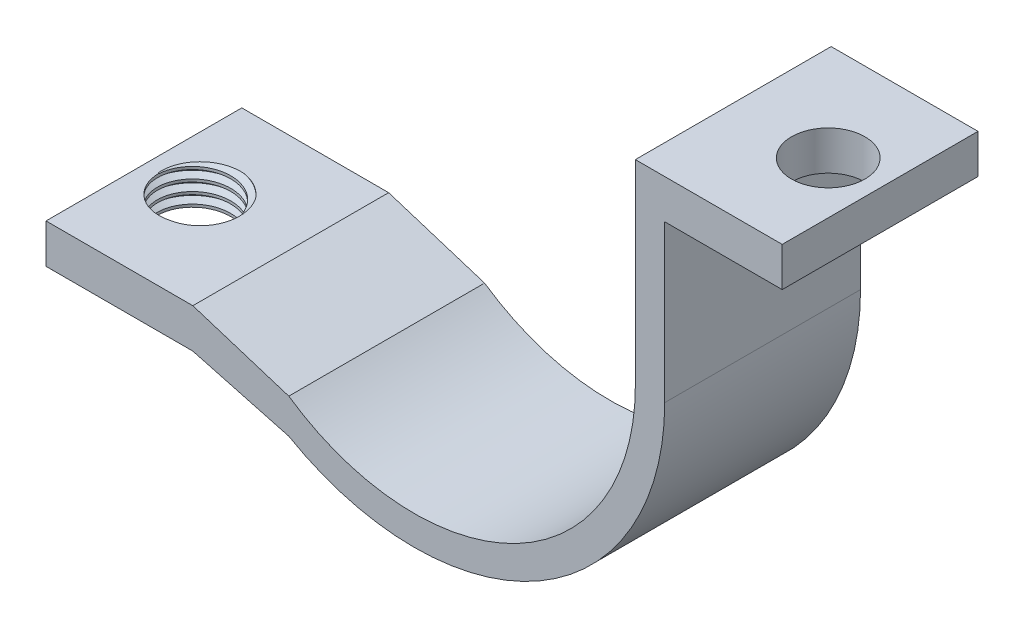
from build123d import *

# Parameters (mm, degrees)
BOSS_EXTRUDE3_DEPTH = 25.4
SKETCH7_R           = 4.7625
CUT_EXTRUDE1_DEPTH  = 54.102
THREAD1_PITCH       = 1.411111111


with BuildPart() as part:
    # Sketch5 → Boss-Extrude3 (new body)
    with BuildSketch(Plane.XY):
        with BuildLine():
            Line((28.702, 0), (28.702, 25.4))
            Line((28.702, 25.4), (32.512, 25.4))
            Line((32.512, 25.4), (47.752, 25.4))
            Line((47.752, 25.4), (47.752, 20.32))
            Line((47.752, 20.32), (32.512, 20.32))
            Line((32.512, 20.32), (32.512, 0))
            ThreePointArc((32.512, 0), (16.256, -28.156217928), (-16.256, -28.156217928))
            Line((-16.256, -28.156217928), (-28.702, -24.821322279))
            Line((-28.702, -24.821322279), (-47.752, -24.821322279))
            Line((-47.752, -24.821322279), (-47.752, -19.716890163))
            Line((-47.752, -19.716890163), (-28.702, -19.716890163))
            Line((-28.702, -19.716890163), (-16.256, -23.654751489))
            ThreePointArc((-16.256, -23.654751489), (13.36460048, -25.400634992), (28.702, 0))
        make_face()
    extrude(amount=BOSS_EXTRUDE3_DEPTH)

    # Sketch7 → Cut-Extrude1 (cut)
    with BuildSketch(Plane(origin=(0, 25.4, 0), x_dir=(1, 0, 0), z_dir=(0, 1, 0))):
        with Locations(Location((-41.021, -12.7, 0), (0, 0, 270))):
            Circle(SKETCH7_R)
        with Locations(Location((41.021, -12.7, 0), (0, 0, 270))):
            Circle(SKETCH7_R)
    extrude(amount=-CUT_EXTRUDE1_DEPTH, mode=Mode.SUBTRACT)

    # Thread1: the profile of Thread Profile1 profile screwed along a right-hand helix of 4.325976 turns, 8 arcs to a turn; built about Z, then put on its axis
    thread1_z = Axis((0, 0, 0), (0, 0, 1))
    thread1_corners = [(4.7622, 0, -0.000173205), (5.52628629, 0, 0.44097222), (5.52628629, 0, 0.617361109), (4.7622, 0, 1.058506535)]
    with BuildLine(mode=Mode.PRIVATE) as thread1_profile:
        Line(thread1_corners[0], thread1_corners[1])
        Line(thread1_corners[1], thread1_corners[2])
        Line(thread1_corners[2], thread1_corners[3])
        Line(thread1_corners[3], thread1_corners[0])
    thread1_cap = Face(thread1_profile.wire())
    thread1_turn_angles = [0, 22.5, 45, 67.5, 90, 112.5, 135, 157.5, 180, 202.5, 225, 247.5, 270, 292.5, 315, 337.5, 360]
    thread1_turn_weights = [1, 0.9238795325112867, 1, 0.9238795325112867, 1, 0.9238795325112867, 1, 0.9238795325112867, 1, 0.9238795325112867, 1, 0.9238795325112867, 1, 0.9238795325112867, 1, 0.9238795325112867, 1]
    thread1_turn_rails = [Edge.make_bspline([Vector(p[0], p[1], 0).rotate(thread1_z, thread1_turn_angles[k]) / thread1_turn_weights[k] + Vector(0, 0, p[2] + THREAD1_PITCH * thread1_turn_angles[k] / 360) for k in range(17)], [0, 0, 0, 1, 1, 2, 2, 3, 3, 4, 4, 5, 5, 6, 6, 7, 7, 8, 8, 8], 2, thread1_turn_weights) for p in thread1_corners]
    thread1_turn_sides = [Face.make_surface_from_curves(thread1_turn_rails[p[0]], thread1_turn_rails[p[1]]) for p in [(0, 1), (1, 2), (2, 3), (3, 0)]]
    thread1_last_angles = [1440, 1462.5, 1485, 1507.5, 1530, 1543.675592726, 1557.351185452]
    thread1_last_weights = [1, 0.9238795325112867, 1, 0.9238795325112867, 1, 0.9716499218833381, 1]
    thread1_last_rails = [Edge.make_bspline([Vector(p[0], p[1], 0).rotate(thread1_z, thread1_last_angles[k]) / thread1_last_weights[k] + Vector(0, 0, p[2] + THREAD1_PITCH * thread1_last_angles[k] / 360) for k in range(7)], [0, 0, 0, 1, 1, 2, 2, 3, 3, 3], 2, thread1_last_weights) for p in thread1_corners]
    thread1_last_sides = [Face.make_surface_from_curves(thread1_last_rails[p[0]], thread1_last_rails[p[1]]) for p in [(0, 1), (1, 2), (2, 3), (3, 0)]]
    thread1 = Plane(origin=(-41.021, -18.716890163, 12.7), x_dir=(-1, 0, 0), z_dir=(0, -1, 0)) * Solid(Shell([*[p.moved(Location((0, 0, THREAD1_PITCH * i))) for i in range(4) for p in thread1_turn_sides], *thread1_last_sides, thread1_cap, thread1_cap.rotate(thread1_z, 1557.351185452).moved(Location((0, 0, THREAD1_PITCH * 1557.351185452 / 360)))]))
    add(thread1, mode=Mode.SUBTRACT)


solid = part.part
